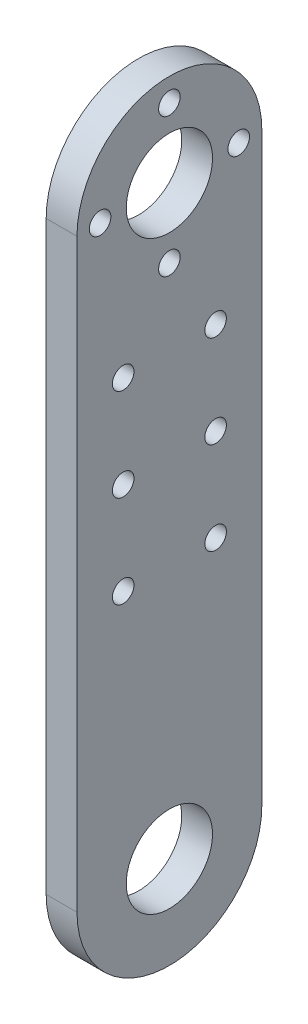
from build123d import *

# Parameters (mm, degrees)
SKETCH_2_W                  = 20
SKETCH_2_H                  = 500
SM_BASE_FLANGE_1_DEPTH      = 120
SKETCH_3_R                  = 28
CUT_EXTRUDE_1_DEPTH         = 515.587213211
CUT_EXTRUDE_START           = -20
CUT_EXTRUDE_2_DEPTH         = 20
HOLE_WIZARD_14_0_14_1_D     = 14
HOLE_WIZARD_14_0_14_1_DEPTH = 45
HOLE_WIZARD_14_0_14_1_TIP   = 4.206024333


# Read off the part's stored shape, not the designer's step: 切除-拉伸2
# Sheet-metal steps are written as plain solids
with BuildPart() as part:
    # 草图2 → 基体-法兰1 (new body)
    with BuildSketch(Plane.XY):
        with Locations((-10, 250)):
            Rectangle(SKETCH_2_W, SKETCH_2_H)
    extrude(amount=SM_BASE_FLANGE_1_DEPTH)

    # 草图3 → 切除-拉伸1 (cut, through all)
    with BuildSketch(Plane(origin=(0, 0, 0), x_dir=(0, 0, -1), z_dir=(1, 0, 0))):
        with Locations(Location((-60, 60, 0), (0, 0, 90))):
            Circle(SKETCH_3_R)
        with Locations(Location((-60, 440, 0), (0, 0, 90))):
            Circle(SKETCH_3_R)
    extrude(amount=-CUT_EXTRUDE_1_DEPTH, mode=Mode.SUBTRACT)

    # 切除-拉伸2 outline → 切除-拉伸2 (cut)
    with BuildSketch(Plane.ZY.offset(20).offset(CUT_EXTRUDE_START)):
        with BuildLine():
            ThreePointArc((60, 0), (17.573593129, 17.573593129), (0, 60))
            Line((0, 60), (0, 0))
            Line((0, 0), (60, 0))
        make_face()
        with BuildLine():
            ThreePointArc((120, 60), (102.426406871, 17.573593129), (60, 0))
            Line((60, 0), (120, 0))
            Line((120, 0), (120, 60))
        make_face()
        with BuildLine():
            Line((0, 500), (0, 440))
            ThreePointArc((0, 440), (17.573593129, 482.426406871), (60, 500))
            Line((60, 500), (0, 500))
        make_face()
        with BuildLine():
            Line((120, 500), (60, 500))
            ThreePointArc((60, 500), (102.426406871, 482.426406871), (120, 440))
            Line((120, 440), (120, 500))
        make_face()
    extrude(amount=CUT_EXTRUDE_2_DEPTH, mode=Mode.SUBTRACT)

    # Ø14.0 (14) 直径孔1
    with Locations(Plane(origin=(0, 0, 0), x_dir=(0, 0, -1), z_dir=(1, 0, 0))):
        with Locations((-60, 485), (-105, 440), (-60, 395), (-15, 440), (-90, 225.486069721), (-90, 285.486069721), (-30, 285.486069721), (-30, 225.486069721), (-30, 345.486069721), (-90, 345.486069721)):
            Hole(HOLE_WIZARD_14_0_14_1_D / 2, depth=HOLE_WIZARD_14_0_14_1_DEPTH)
            with Locations((0, 0, -(HOLE_WIZARD_14_0_14_1_DEPTH + HOLE_WIZARD_14_0_14_1_TIP / 2))):  # 118° drill point
                Cone(0, HOLE_WIZARD_14_0_14_1_D / 2, HOLE_WIZARD_14_0_14_1_TIP, mode=Mode.SUBTRACT)


solid = part.part
